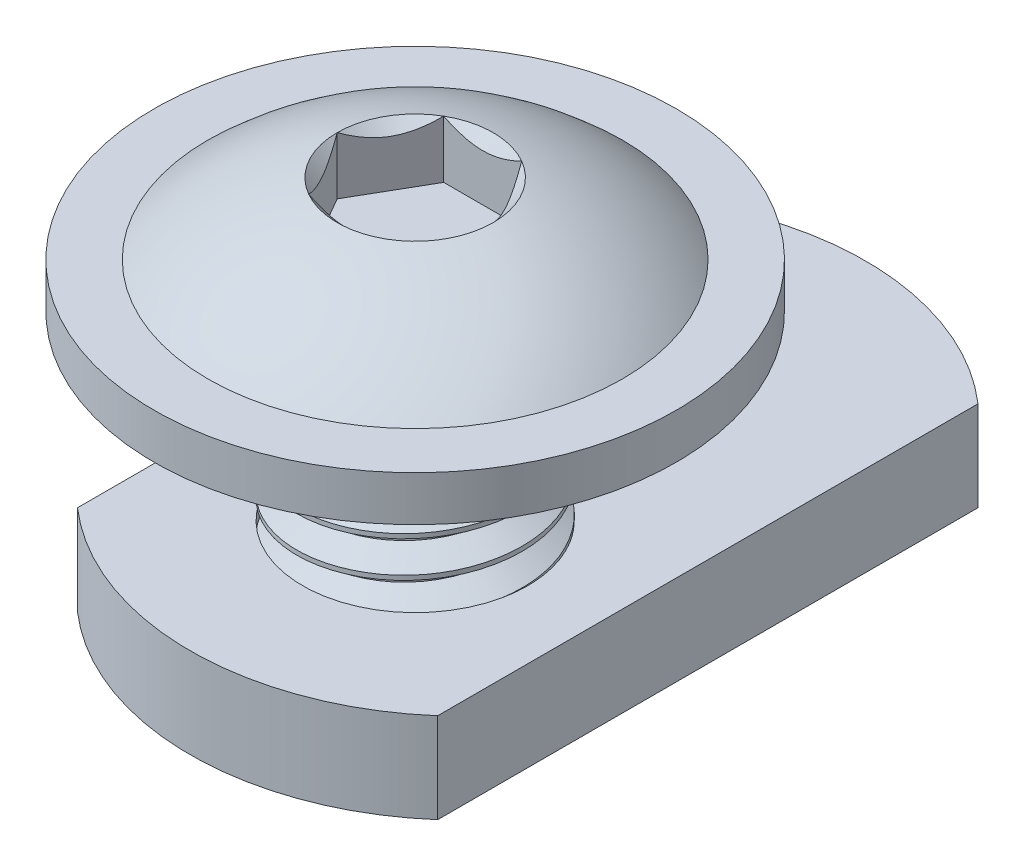
from build123d import *

# Parameters (mm, degrees)
SKETCH2_W                    = 2.5
SKETCH2_H                    = 8
CHAMFER1_SIZE                = 0.8
CUT_SWEEP1_PITCH             = 0.8
SKETCH20_R                   = 5.8
BOSS_EXTRUDE1_DEPTH          = 1
CUT_EXTRUDE1_DEPTH           = 1.5
SKETCH7_R                    = 1.732050808
CUT_EXTRUDE2_DEPTH           = 1.274952
CUT_EXTRUDE2_TAPER           = 45
CUT_EXTRUDE2_OTHER_WAY_DEPTH = 14.383184255
SKETCH8_R                    = 2.5
EXTRUDE1_DEPTH               = 1.5
SKETCH9_R                    = 3
CUT_EXTRUDE3_DEPTH           = 1


with BuildPart() as part:
    # Sketch2 → Revolve2 (revolve)
    with BuildSketch(Plane.XY, mode=Mode.PRIVATE) as revolve2_sk:
        with Locations((-1.25, 4)):
            Rectangle(SKETCH2_W, SKETCH2_H)
    revolve(revolve2_sk.sketch.rotate(Axis((0, 0, 0), (0, 1, 0)), 270), axis=Axis((0, 0, 0), (0, 1, 0)))

    # Chamfer1
    chamfer1_edges = [part.edges().sort_by_distance(p)[0] for p in [
        (0, 0, 2.5),
    ]]
    chamfer(chamfer1_edges, length=CHAMFER1_SIZE)

    # Cut-Sweep1: the profile of Sketch4 profile screwed along a right-hand helix of 10.234375 turns, 6 arcs to a turn; built about Z, then put on its axis
    cut_sweep1_z = Axis((0, 0, 0), (0, 0, 1))
    cut_sweep1_corners = [(2.5003, 0, -0.700173205), (2.5003, 0, 0.000173205), (1.980384758, 0, -0.3), (1.980384758, 0, -0.4)]
    with BuildLine(mode=Mode.PRIVATE) as cut_sweep1_profile:
        Line(cut_sweep1_corners[0], cut_sweep1_corners[1])
        Line(cut_sweep1_corners[1], cut_sweep1_corners[2])
        Line(cut_sweep1_corners[2], cut_sweep1_corners[3])
        Line(cut_sweep1_corners[3], cut_sweep1_corners[0])
    cut_sweep1_cap = Face(cut_sweep1_profile.wire())
    cut_sweep1_turn_angles = [0, 30, 60, 90, 120, 150, 180, 210, 240, 270, 300, 330, 360]
    cut_sweep1_turn_weights = [1, 0.8660254037844387, 1, 0.8660254037844387, 1, 0.8660254037844387, 1, 0.8660254037844387, 1, 0.8660254037844387, 1, 0.8660254037844387, 1]
    cut_sweep1_turn_rails = [Edge.make_bspline([Vector(p[0], p[1], 0).rotate(cut_sweep1_z, cut_sweep1_turn_angles[k]) / cut_sweep1_turn_weights[k] + Vector(0, 0, p[2] + CUT_SWEEP1_PITCH * cut_sweep1_turn_angles[k] / 360) for k in range(13)], [0, 0, 0, 1, 1, 2, 2, 3, 3, 4, 4, 5, 5, 6, 6, 6], 2, cut_sweep1_turn_weights) for p in cut_sweep1_corners]
    cut_sweep1_turn_sides = [Face.make_surface_from_curves(cut_sweep1_turn_rails[p[0]], cut_sweep1_turn_rails[p[1]]) for p in [(0, 1), (1, 2), (2, 3), (3, 0)]]
    cut_sweep1_last_angles = [3600, 3630, 3660, 3672.1875, 3684.375]
    cut_sweep1_last_weights = [1, 0.8660254037844387, 1, 0.9774619749435752, 1]
    cut_sweep1_last_rails = [Edge.make_bspline([Vector(p[0], p[1], 0).rotate(cut_sweep1_z, cut_sweep1_last_angles[k]) / cut_sweep1_last_weights[k] + Vector(0, 0, p[2] + CUT_SWEEP1_PITCH * cut_sweep1_last_angles[k] / 360) for k in range(5)], [0, 0, 0, 1, 1, 2, 2, 2], 2, cut_sweep1_last_weights) for p in cut_sweep1_corners]
    cut_sweep1_last_sides = [Face.make_surface_from_curves(cut_sweep1_last_rails[p[0]], cut_sweep1_last_rails[p[1]]) for p in [(0, 1), (1, 2), (2, 3), (3, 0)]]
    cut_sweep1 = Plane(origin=(0, 8, 0), x_dir=(1, 0, 0), z_dir=(0, -1, 0)) * Solid(Shell([*[p.moved(Location((0, 0, CUT_SWEEP1_PITCH * i))) for i in range(10) for p in cut_sweep1_turn_sides], *cut_sweep1_last_sides, cut_sweep1_cap, cut_sweep1_cap.rotate(cut_sweep1_z, 3684.375).moved(Location((0, 0, CUT_SWEEP1_PITCH * 3684.375 / 360)))]))
    add(cut_sweep1, mode=Mode.SUBTRACT)

    # Sketch5 → Revolve3 (revolve)
    with BuildSketch(Plane.XY):
        with BuildLine():
            Line((0, 8), (0, 10.8))
            ThreePointArc((0, 10.8), (-2.469817807, 10.33397884), (-4.6, 9))
            Line((-4.6, 9), (-4.6, 8))
            Line((-4.6, 8), (0, 8))
        make_face()
    revolve(axis=Axis((0, 0, 0), (0, 1, 0)))

    # Sketch20 → Boss-Extrude1 (add)
    with BuildSketch(Plane.XZ.offset(-8)):
        with Locations(Location((0, 0, 0), (0, 0, 270))):
            Circle(SKETCH20_R)
    extrude(amount=-BOSS_EXTRUDE1_DEPTH)

    # Sketch6 → Cut-Extrude1 (cut)
    with BuildSketch(Plane(origin=(0, 10.8, 0), x_dir=(-1, 0, 0), z_dir=(0, 1, 0))):
        Polygon((0.866025404, 1.5), (-0.866025404, 1.5), (-1.732050808, 0), (-0.866025404, -1.5), (0.866025404, -1.5), (1.732050808, 0), align=None)
    extrude(amount=-CUT_EXTRUDE1_DEPTH, mode=Mode.SUBTRACT)

    # Sketch7 → Cut-Extrude2 (cut)
    with BuildSketch(Plane(origin=(0, 10.57495231, 0), x_dir=(-1, 0, 0), z_dir=(0, 1, 0))):
        Circle(SKETCH7_R)
    extrude(amount=-CUT_EXTRUDE2_DEPTH, taper=CUT_EXTRUDE2_TAPER, mode=Mode.SUBTRACT)

    # Sketch7 → Cut-Extrude2 other way (cut)
    with BuildSketch(Plane(origin=(0, 10.57495231, 0), x_dir=(-1, 0, 0), z_dir=(0, 1, 0))):
        Circle(SKETCH7_R)
    extrude(amount=CUT_EXTRUDE2_OTHER_WAY_DEPTH, mode=Mode.SUBTRACT)


with BuildPart() as body_2:
    # Sketch8 → Extrude1 (new, symmetric)
    with BuildSketch(Plane.XZ.offset(-2.475)):
        with BuildLine():
            Line((-4, 3.5), (-4, -8.5))
            ThreePointArc((-4, -8.5), (0, -10), (4, -8.5))
            Line((4, -8.5), (4, 3.5))
            ThreePointArc((4, 3.5), (0, 5), (-4, 3.5))
        make_face()
        with Locations(Location((0, 0, 0), (0, 0, 270))):
            Circle(SKETCH8_R, mode=Mode.SUBTRACT)
    extrude(amount=EXTRUDE1_DEPTH, both=True)

    # Sketch9 → Cut-Extrude3 (cut)
    with BuildSketch(Plane.XZ.offset(-0.975)):
        with BuildLine():
            Line((4, -8.5), (4, 3.5))
            ThreePointArc((4, 3.5), (0, 5), (-4, 3.5))
            Line((-4, 3.5), (-4, -8.5))
            ThreePointArc((-4, -8.5), (0, -10), (4, -8.5))
        make_face()
        with Locations(Location((0, 0, 0), (0, 0, 270))):
            Circle(SKETCH9_R, mode=Mode.SUBTRACT)
    extrude(amount=-CUT_EXTRUDE3_DEPTH, mode=Mode.SUBTRACT)


solid = Compound([part.part, body_2.part])
